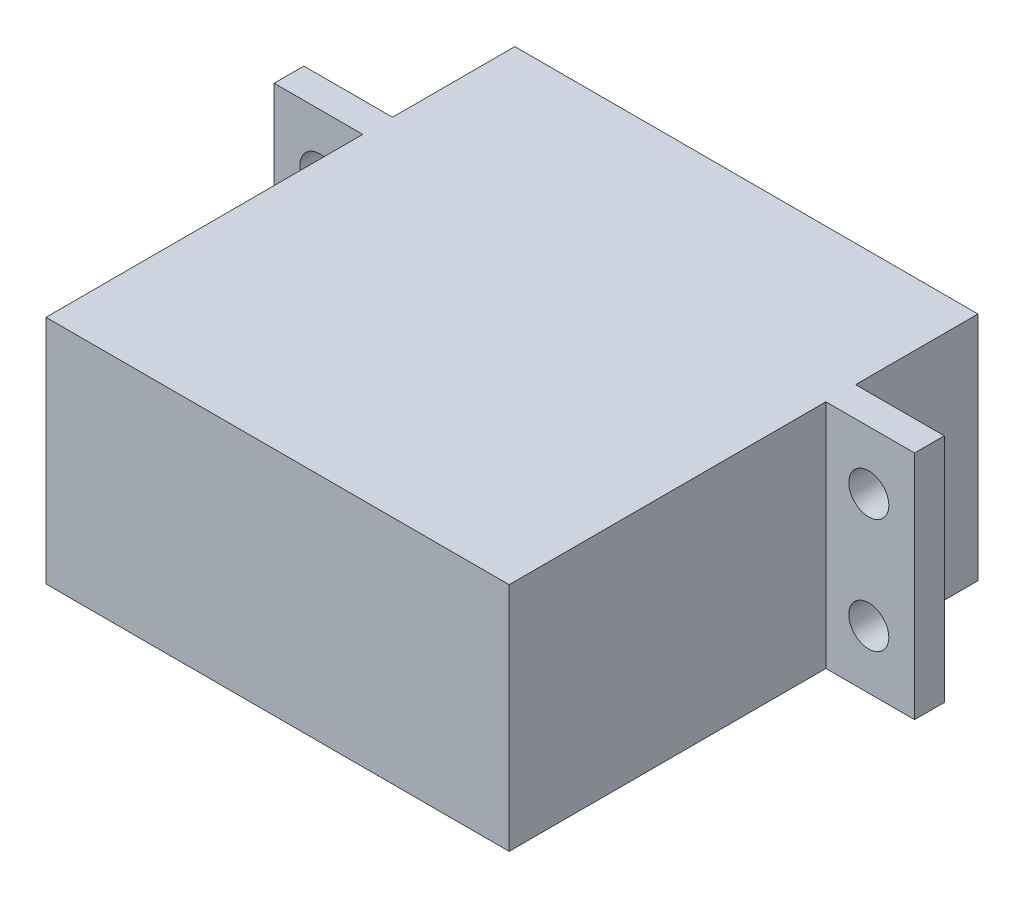
from build123d import *

# Parameters (mm, degrees)
SKETCH_1_W          = 40.5
SKETCH_1_H          = 20.2
EXTRUDE_1_DEPTH     = 41
SKETCH_2_W          = 56
SKETCH_2_H          = 20.2
EXTRUDE_2_DEPTH     = 2.6
SKETCH_3_R          = 1.75
CUT_EXTRUDE_1_DEPTH = 2.6
SKETCH_4_R          = 2
EXTRUDE_3_DEPTH     = 4


# Read off the part's stored shape, not the designer's step: M3 螺纹孔1
with BuildPart() as part:
    # 草图1 → 凸台-拉伸1 (new body)
    with BuildSketch(Plane.XY):
        Rectangle(SKETCH_1_W, SKETCH_1_H)
    extrude(amount=EXTRUDE_1_DEPTH)

    # 草图2 → 凸台-拉伸2 (add)
    with BuildSketch(Plane.XY.offset(13.3)):
        Rectangle(SKETCH_2_W, SKETCH_2_H)
    extrude(amount=-EXTRUDE_2_DEPTH)

    # 草图3 → 切除-拉伸1 (cut)
    with BuildSketch(Plane(origin=(0, 0, 10.7), x_dir=(-1, 0, 0), z_dir=(0, 0, -1))):
        with Locations((-24, 5)):
            Circle(SKETCH_3_R)
        with Locations(Location((24, 5, 0), (0, 0, 180))):
            Circle(SKETCH_3_R)
        with Locations((24, -5)):
            Circle(SKETCH_3_R)
        with Locations(Location((-24, -5, 0), (0, 0, 180))):
            Circle(SKETCH_3_R)
    extrude(amount=-CUT_EXTRUDE_1_DEPTH, mode=Mode.SUBTRACT)

    # 草图4 → 凸台-拉伸3 (add)
    with BuildSketch(Plane(origin=(0, 0, 0), x_dir=(-1, 0, 0), z_dir=(0, 0, -1))):
        with Locations((9.75, 0)):
            Circle(SKETCH_4_R)
    extrude(amount=EXTRUDE_3_DEPTH)

    # M3 螺纹孔1 outline → M3 螺纹孔1 (revolve, cut)
    with BuildSketch(Plane(origin=(-9.75, 0, 0), x_dir=(1, 0, 0), z_dir=(0, -1, 0))):
        Polygon((1.25, 0), (0, 0.751075774), (0, -4), (1.25, -4), align=None)
    revolve(axis=Axis((-9.75, 0, 0), (0, 0, 1)), mode=Mode.SUBTRACT)


solid = part.part
